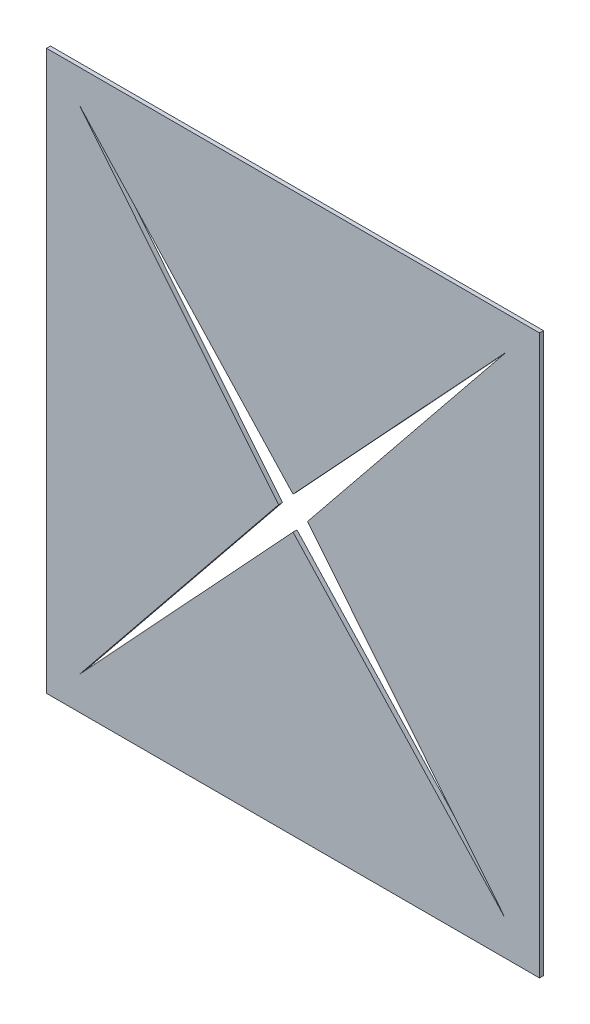
from build123d import *

# Parameters (mm, degrees)
SKETCH1_W           = 95.25
SKETCH1_H           = 107.95
BOSS_EXTRUDE1_DEPTH = 0.762


with BuildPart() as part:
    # Sketch1 → Boss-Extrude1 (new body)
    with BuildSketch(Plane.XY):
        Rectangle(SKETCH1_W, SKETCH1_H)
        Polygon((-2.801470588, 0), (-41.275, 47.625), (0, 3.175), (41.275, 47.625), (2.801470588, 0), (41.275, -47.625), (0, -3.175), (-41.275, -47.625), align=None, mode=Mode.SUBTRACT)
    extrude(amount=BOSS_EXTRUDE1_DEPTH)


solid = part.part
